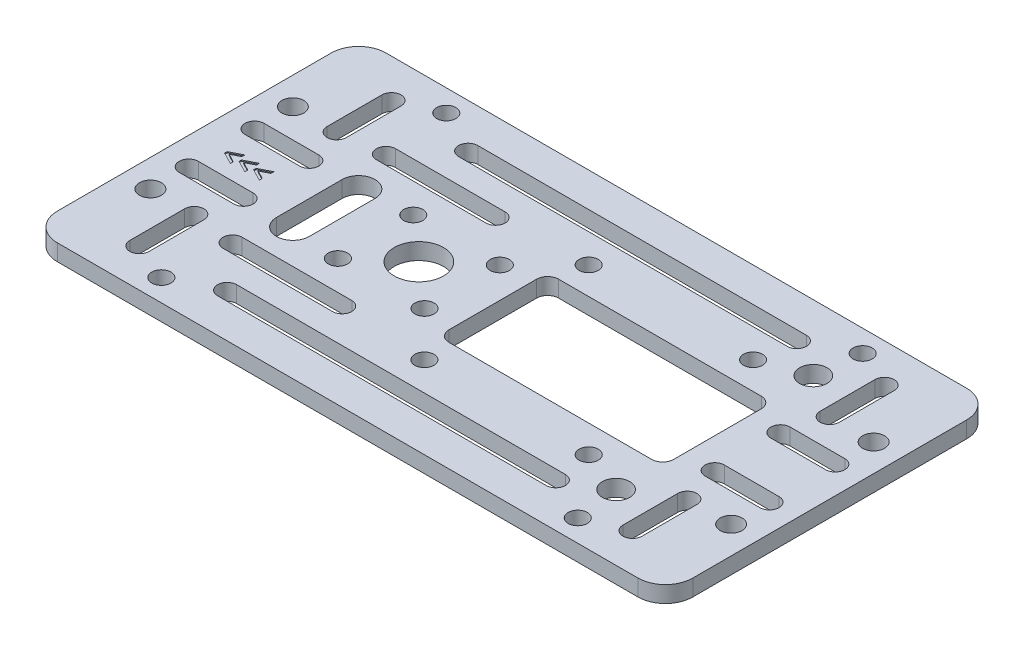
from build123d import *

# Parameters (mm, degrees)
SKETCH1_W              = 116
SKETCH1_H              = 60
SKETCH1_R              = 2
BOSS_EXTRUDE1_DEPTH    = 3
SKETCH2_R              = 1.75
ODROID_HOLES_DEPTH     = 66.368187982
CUT_EXTRUDE2_DEPTH     = 0.2
SKETCH4_R              = 1.75
PIXHAWK_PM_DEPTH       = 66.368187982
SKETCH5_R              = 1.75
BUCKCONVERTER_5A_DEPTH = 66.368187982
SKETCH6_R              = 2.5
SKETCH6_R_2            = 4.5
CUT_EXTRUDE5_DEPTH     = 66.368187982
FILLET1_R              = 5


with BuildPart() as part:
    # Sketch1 → Boss-Extrude1 (new body)
    with BuildSketch(Plane(origin=(0, 0, 0), x_dir=(1, 0, 0), z_dir=(0, 1, 0))):
        Rectangle(SKETCH1_W, SKETCH1_H)
        with Locations((53, 13)):
            Circle(SKETCH1_R, mode=Mode.SUBTRACT)
        with Locations((53, -13)):
            Circle(SKETCH1_R, mode=Mode.SUBTRACT)
        with Locations((-53, -13)):
            Circle(SKETCH1_R, mode=Mode.SUBTRACT)
        with Locations((-53, 13)):
            Circle(SKETCH1_R, mode=Mode.SUBTRACT)
    extrude(amount=BOSS_EXTRUDE1_DEPTH)

    # Sketch2 → Odroid-holes (cut, through all)
    with BuildSketch(Plane(origin=(0, 3, 0), x_dir=(1, 0, 0), z_dir=(0, 1, 0))):
        with Locations((38, 26)):
            Circle(SKETCH2_R)
        with Locations((38, -26)):
            Circle(SKETCH2_R)
        with Locations((-38, -26)):
            Circle(SKETCH2_R)
        with Locations((-38, 26)):
            Circle(SKETCH2_R)
    extrude(amount=-ODROID_HOLES_DEPTH, mode=Mode.SUBTRACT)

    # Sketch3 → Cut-Extrude2 (cut)
    with BuildSketch(Plane(origin=(0, 3, 0), x_dir=(1, 0, 0), z_dir=(0, 1, 0))):
        Polygon((-49.756039442, -1.122419343), (-49.756039442, -1.666214416), (-51.913411237, -0.552547549), (-51.913411237, -0.104155121), (-49.756039442, 1.009511746), (-49.756039442, 0.465080657), (-51.293930067, -0.328669343), align=None)
        Polygon((-47.110206109, -1.122419343), (-47.110206109, -1.666214416), (-49.267577904, -0.552547549), (-49.267577904, -0.104155121), (-47.110206109, 1.009511746), (-47.110206109, 0.465080657), (-48.648096734, -0.328669343), align=None)
        Polygon((-44.464372776, -1.122419343), (-44.464372776, -1.666214416), (-46.621744571, -0.552547549), (-46.621744571, -0.104155121), (-44.464372776, 1.009511746), (-44.464372776, 0.465080657), (-46.002263401, -0.328669343), align=None)
    extrude(amount=-CUT_EXTRUDE2_DEPTH, mode=Mode.SUBTRACT)

    # Sketch4 → Pixhawk-PM (cut, through all)
    with BuildSketch(Plane(origin=(0, 3, 0), x_dir=(1, 0, 0), z_dir=(0, 1, 0))):
        with Locations((-1, 15)):
            Circle(SKETCH4_R)
        with Locations((29, 15)):
            Circle(SKETCH4_R)
        with Locations((29, -15)):
            Circle(SKETCH4_R)
        with Locations((-1, -15)):
            Circle(SKETCH4_R)
    extrude(amount=-PIXHAWK_PM_DEPTH, mode=Mode.SUBTRACT)

    # Sketch5 → BuckConverter-5A (cut, through all)
    with BuildSketch(Plane(origin=(0, 3, 0), x_dir=(1, 0, 0), z_dir=(0, 1, 0))):
        with Locations((-9.1, 6.875)):
            Circle(SKETCH5_R)
        with Locations((-24.9, 6.875)):
            Circle(SKETCH5_R)
        with Locations((-24.9, -6.875)):
            Circle(SKETCH5_R)
        with Locations((-9.1, -6.875)):
            Circle(SKETCH5_R)
    extrude(amount=-BUCKCONVERTER_5A_DEPTH, mode=Mode.SUBTRACT)

    # Sketch6 → Cut-Extrude5 (cut, through all)
    with BuildSketch(Plane(origin=(0, 3, 0), x_dir=(1, 0, 0), z_dir=(0, 1, 0))):
        with BuildLine():
            Line((30, 23.75), (-30, 23.75))
            ThreePointArc((-30, 23.75), (-31.75, 22), (-30, 20.25))
            Line((-30, 20.25), (30, 20.25))
            ThreePointArc((30, 20.25), (31.75, 22), (30, 23.75))
        make_face()
        with BuildLine():
            ThreePointArc((-30, -20.25), (-31.75, -22), (-30, -23.75))
            Line((-30, -23.75), (30, -23.75))
            ThreePointArc((30, -23.75), (31.75, -22), (30, -20.25))
            Line((30, -20.25), (-30, -20.25))
        make_face()
        with BuildLine():
            Line((-17, 15.75), (-37, 15.75))
            ThreePointArc((-37, 15.75), (-38.75, 14), (-37, 12.25))
            Line((-37, 12.25), (-17, 12.25))
            ThreePointArc((-17, 12.25), (-15.25, 14), (-17, 15.75))
        make_face()
        with BuildLine():
            ThreePointArc((-37, -12.25), (-38.75, -14), (-37, -15.75))
            Line((-37, -15.75), (-17, -15.75))
            ThreePointArc((-17, -15.75), (-15.25, -14), (-17, -12.25))
            Line((-17, -12.25), (-37, -12.25))
        make_face()
        with BuildLine():
            Line((-43.25, 13), (-43.25, 23))
            ThreePointArc((-43.25, 23), (-45, 24.75), (-46.75, 23))
            Line((-46.75, 23), (-46.75, 13))
            ThreePointArc((-46.75, 13), (-45, 11.25), (-43.25, 13))
        make_face()
        with BuildLine():
            ThreePointArc((-46.75, -23), (-45, -24.75), (-43.25, -23))
            Line((-43.25, -23), (-43.25, -13))
            ThreePointArc((-43.25, -13), (-45, -11.25), (-46.75, -13))
            Line((-46.75, -13), (-46.75, -23))
        make_face()
        with BuildLine():
            ThreePointArc((46.75, 23), (45, 24.75), (43.25, 23))
            Line((43.25, 23), (43.25, 13))
            ThreePointArc((43.25, 13), (45, 11.25), (46.75, 13))
            Line((46.75, 13), (46.75, 23))
        make_face()
        with BuildLine():
            Line((43.25, -13), (43.25, -23))
            ThreePointArc((43.25, -23), (45, -24.75), (46.75, -23))
            Line((46.75, -23), (46.75, -13))
            ThreePointArc((46.75, -13), (45, -11.25), (43.25, -13))
        make_face()
        with BuildLine():
            Line((53, 7.75), (43, 7.75))
            ThreePointArc((43, 7.75), (41.25, 6), (43, 4.25))
            Line((43, 4.25), (53, 4.25))
            ThreePointArc((53, 4.25), (54.75, 6), (53, 7.75))
        make_face()
        with BuildLine():
            ThreePointArc((43, -4.25), (41.25, -6), (43, -7.75))
            Line((43, -7.75), (53, -7.75))
            ThreePointArc((53, -7.75), (54.75, -6), (53, -4.25))
            Line((53, -4.25), (43, -4.25))
        make_face()
        with BuildLine():
            ThreePointArc((-43, 4.25), (-41.25, 6), (-43, 7.75))
            Line((-43, 7.75), (-53, 7.75))
            ThreePointArc((-53, 7.75), (-54.75, 6), (-53, 4.25))
            Line((-53, 4.25), (-43, 4.25))
        make_face()
        with BuildLine():
            Line((-53, -7.75), (-43, -7.75))
            ThreePointArc((-43, -7.75), (-41.25, -6), (-43, -4.25))
            Line((-43, -4.25), (-53, -4.25))
            ThreePointArc((-53, -4.25), (-54.75, -6), (-53, -7.75))
        make_face()
        with BuildLine():
            Line((35.5, 10), (-1.5, 10))
            ThreePointArc((-1.5, 10), (-2.914213562, 9.414213562), (-3.5, 8))
            Line((-3.5, 8), (-3.5, -8))
            ThreePointArc((-3.5, -8), (-2.914213562, -9.414213562), (-1.5, -10))
            Line((-1.5, -10), (35.5, -10))
            ThreePointArc((35.5, -10), (36.914213562, -9.414213562), (37.5, -8))
            Line((37.5, -8), (37.5, 8))
            ThreePointArc((37.5, 8), (36.914213562, 9.414213562), (35.5, 10))
        make_face()
        with BuildLine():
            Line((-31, -6), (-31, 6))
            ThreePointArc((-31, 6), (-34, 9), (-37, 6))
            Line((-37, 6), (-37, -6))
            ThreePointArc((-37, -6), (-34, -9), (-31, -6))
        make_face()
        with Locations((37, 18)):
            Circle(SKETCH6_R)
        with Locations((37, -18)):
            Circle(SKETCH6_R)
        with Locations((-17, 0)):
            Circle(SKETCH6_R_2)
    extrude(amount=-CUT_EXTRUDE5_DEPTH, mode=Mode.SUBTRACT)

    # Fillet1
    fillet1_edges = [part.edges().sort_by_distance(p)[0] for p in [
        (58, 1.5, -30),
        (58, 1.5, 30),
        (-58, 1.5, 30),
        (-58, 1.5, -30),
    ]]
    fillet(fillet1_edges, radius=FILLET1_R)


solid = part.part
